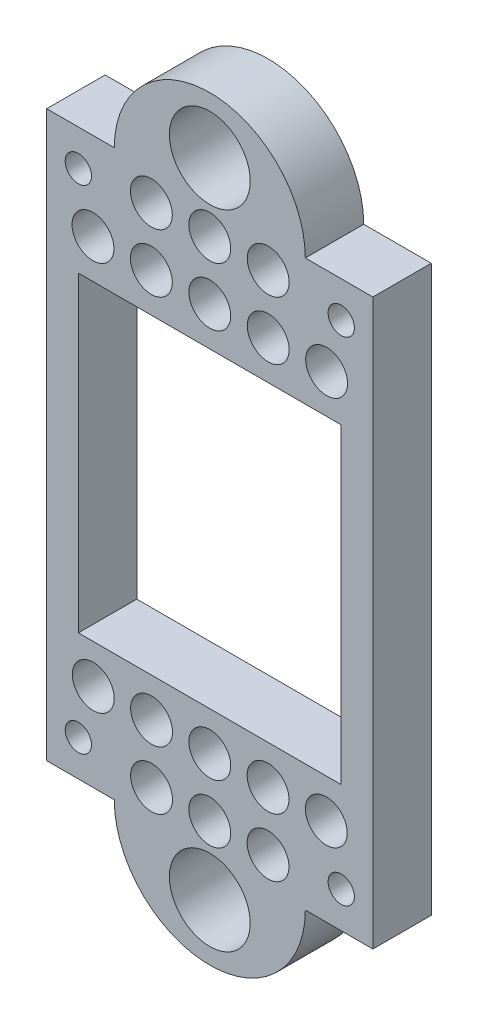
from build123d import *

# Parameters (mm, degrees)
SKETCH1_R           = 1.35
SKETCH1_R_2         = 4.15
SKETCH1_W           = 27
SKETCH1_H           = 32
BOSS_EXTRUDE1_DEPTH = 6
SKETCH2_R           = 2.15
CUT_EXTRUDE1_DEPTH  = 4.2


with BuildPart() as part:
    # Sketch1 → Boss-Extrude1 (new body)
    with BuildSketch(Plane.XY):
        with BuildLine():
            Line((-16.75, 29), (-9.811495363, 29))
            ThreePointArc((-9.811495363, 29), (0, 38.811495363), (9.811495363, 29))
            Line((9.811495363, 29), (16.75, 29))
            Line((16.75, 29), (16.75, -29))
            Line((16.75, -29), (9.811495363, -29))
            ThreePointArc((9.811495363, -29), (0, -38.811495363), (-9.811495363, -29))
            Line((-9.811495363, -29), (-16.75, -29))
            Line((-16.75, -29), (-16.75, 29))
        make_face()
        with Locations((-13.5, 25.3)):
            Circle(SKETCH1_R, mode=Mode.SUBTRACT)
        with Locations((13.5, -25.3)):
            Circle(SKETCH1_R, mode=Mode.SUBTRACT)
        with Locations((-13.5, -25.3)):
            Circle(SKETCH1_R, mode=Mode.SUBTRACT)
        with Locations((13.5, 25.3)):
            Circle(SKETCH1_R, mode=Mode.SUBTRACT)
        with Locations((0, 33)):
            Circle(SKETCH1_R_2, mode=Mode.SUBTRACT)
        with Locations((0, -33)):
            Circle(SKETCH1_R_2, mode=Mode.SUBTRACT)
        Rectangle(SKETCH1_W, SKETCH1_H, mode=Mode.SUBTRACT)
    extrude(amount=BOSS_EXTRUDE1_DEPTH)

    # Sketch2 → Cut-Extrude1 (cut)
    with BuildSketch(Plane.XY.offset(6)):
        with Locations((-12, 20)):
            Circle(SKETCH2_R)
        with Locations((-6, 20)):
            Circle(SKETCH2_R)
        with Locations((0, 20)):
            Circle(SKETCH2_R)
        with Locations((6, 20)):
            Circle(SKETCH2_R)
        with Locations((12, 20)):
            Circle(SKETCH2_R)
        with Locations((-6, 26)):
            Circle(SKETCH2_R)
        with Locations((0, 26)):
            Circle(SKETCH2_R)
        with Locations((6, 26)):
            Circle(SKETCH2_R)
        with Locations((-11.967349369, -20)):
            Circle(SKETCH2_R)
        with Locations((-5.983674685, -20)):
            Circle(SKETCH2_R)
        with Locations((0, -20)):
            Circle(SKETCH2_R)
        with Locations((5.983674685, -20)):
            Circle(SKETCH2_R)
        with Locations((11.967349369, -20)):
            Circle(SKETCH2_R)
        with Locations((-5.983674685, -26)):
            Circle(SKETCH2_R)
        with Locations((0, -26)):
            Circle(SKETCH2_R)
        with Locations((5.983674685, -26)):
            Circle(SKETCH2_R)
    extrude(amount=-CUT_EXTRUDE1_DEPTH, mode=Mode.SUBTRACT)


solid = part.part
